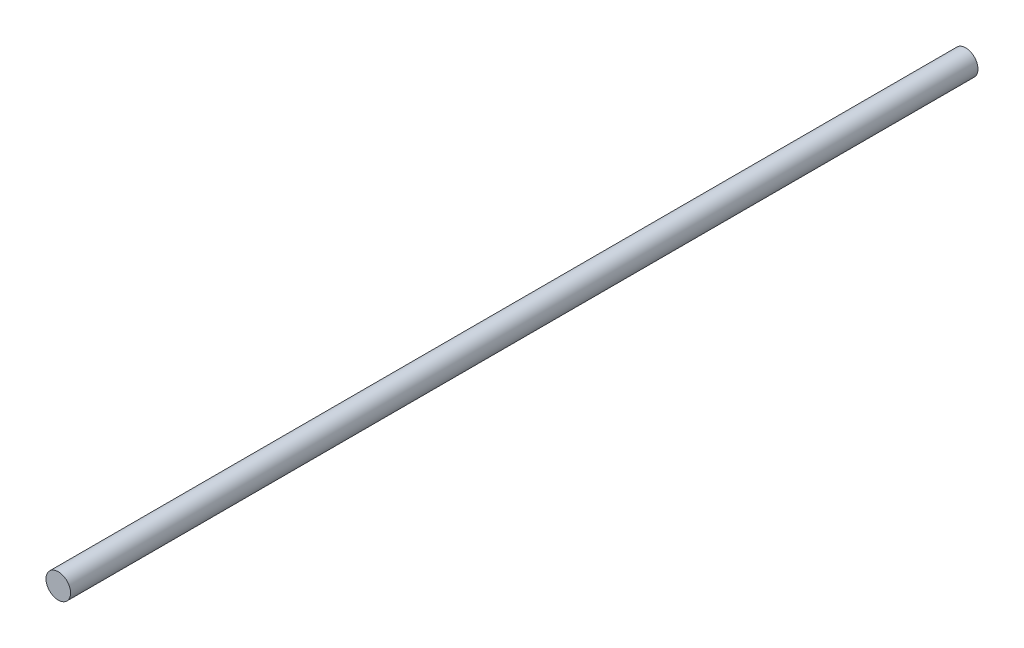
from build123d import *

# Parameters (mm, degrees)
SKETCH2_W = 295
SKETCH2_H = 4


with BuildPart() as part:
    # Sketch2 → Revolve1 (revolve)
    with BuildSketch(Plane(origin=(0, 0, 0), x_dir=(0, 0, -1), z_dir=(1, 0, 0))):
        with Locations((147.5, 2)):
            Rectangle(SKETCH2_W, SKETCH2_H)
    revolve(axis=Axis((0, 0, 0), (0, 0, -1)))


solid = part.part
